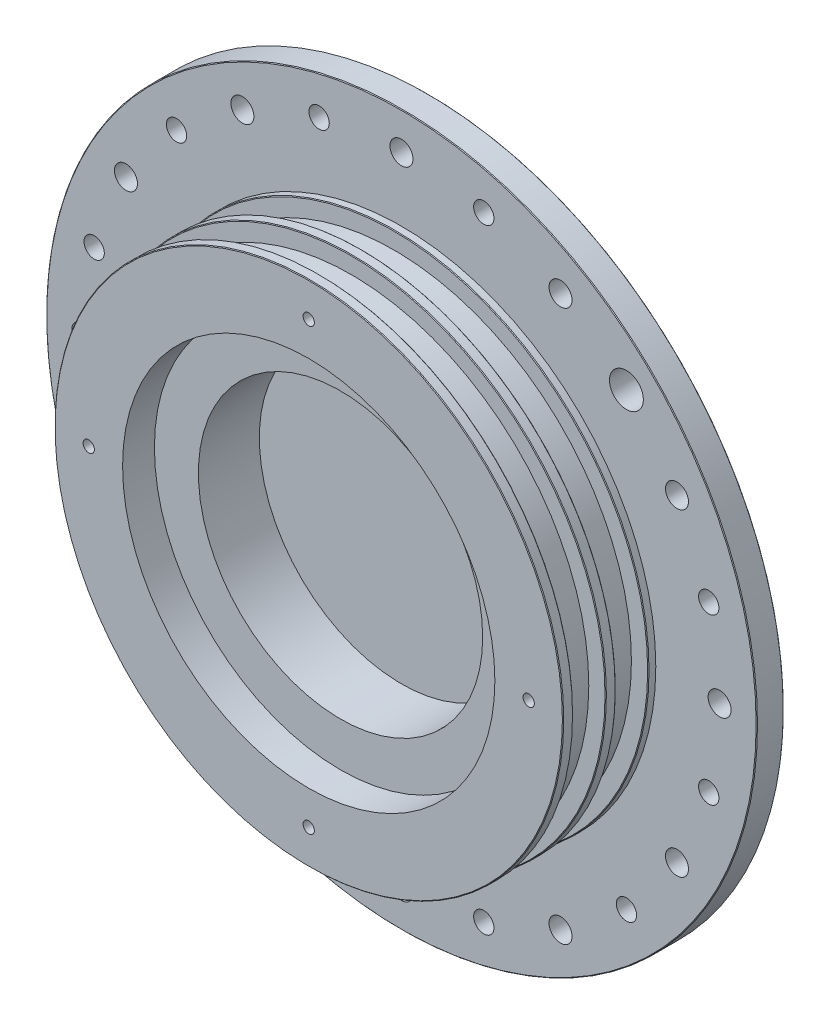
from build123d import *

# Parameters (mm, degrees)
DIAM_TRE_DU_PER_AGE_9_0_9_1_D     = 9
DIAM_TRE_DU_PER_AGE_9_0_9_1_DEPTH = 3
D_GAGEMENT_M31_D                  = 3.332
D_GAGEMENT_M31_DEPTH              = 16
D_GAGEMENT_M31_TIP                = 1.001033791
D_GAGEMENT_M1001_D                = 110
D_GAGEMENT_M1001_DEPTH            = 27.4
ESQUISSE8_R                       = 105
ESQUISSE8_R_2                     = 77.5
BOSS_EXTRU_1_DEPTH                = 8
ESQUISSE9_R                       = 3.4
ENL_V_MAT_EXTRU_1_DEPTH           = 20
ENL_V_MAT_EXTRU_15_DEPTH          = 153.653725798
ENL_V_MAT_EXTRU_15_DEPTH_BACK     = 153.653725798
ESQUISSE24_R                      = 3
ESQUISSE24_R_2                    = 5.1
ESQUISSE24_R_3                    = 5
CHANFREIN1_SIZE                   = 0.2
ENL_V_MAT_EXTRU_18_DEPTH          = 2
ESQUISSE35_R                      = 55
ESQUISSE35_R_2                    = 42
BOSS_EXTRU_4_DEPTH                = 18
BOSS_EXTRU_5_START                = -5
ESQUISSE36_R                      = 5.1
BOSS_EXTRU_5_DEPTH                = 5
ESQUISSE9_2_R                     = 3.4
ENL_V_MAT_EXTRU_20_DEPTH          = 20
R_P_TITION_CIRCULAIRE1_COUNT      = 8


with BuildPart() as part:
    # Esquisse1 → Révolution1 (revolve)
    with BuildSketch(Plane(origin=(0, 0, 0), x_dir=(1, 0, 0), z_dir=(0, 1, 0))):
        Polygon((87.5, 35.4), (0, 35.4), (0, 0), (75.15, 0), (75.15, 3), (70.15, 3), (70.15, 12.6), (75.15, 12.6), (75.15, 15.6), (70.15, 15.6), (70.15, 25.2), (75.15, 25.2), (75.15, 27.4), (87.5, 27.4), align=None)
    revolve(axis=Axis((0, 0, -35.4), (0, 0, 1)))

    # Diamètre du perçage Ø9.0 (9)1
    with Locations(Plane.XY.offset(-27.4)):
        with Locations((-87.5, 0), (0, 87.5), (0, -87.5), (87.5, 0)):
            Hole(DIAM_TRE_DU_PER_AGE_9_0_9_1_D / 2, depth=DIAM_TRE_DU_PER_AGE_9_0_9_1_DEPTH)

    # Dégagement M31
    with Locations(Plane.XY):
        with Locations((-65, 0), (65, 0), (0, 65), (0, -65)):
            Hole(D_GAGEMENT_M31_D / 2, depth=D_GAGEMENT_M31_DEPTH)
            with Locations((0, 0, -(D_GAGEMENT_M31_DEPTH + D_GAGEMENT_M31_TIP / 2))):  # 118° drill point
                Cone(0, D_GAGEMENT_M31_D / 2, D_GAGEMENT_M31_TIP, mode=Mode.SUBTRACT)

    # Dégagement M1001
    with Locations(Plane.XY):
        with Locations((0, 0)):
            Hole(D_GAGEMENT_M1001_D / 2, depth=D_GAGEMENT_M1001_DEPTH)

    # Esquisse8 → Boss.-Extru.1 (add)
    with BuildSketch(Plane(origin=(0, 0, -35.4), x_dir=(-1, 0, 0), z_dir=(0, 0, -1))):
        Circle(ESQUISSE8_R)
        Circle(ESQUISSE8_R_2, mode=Mode.SUBTRACT)
    extrude(amount=-BOSS_EXTRU_1_DEPTH)

    # Esquisse9 → Enlèv. mat.-Extru.1 (cut)
    with BuildSketch(Plane.XY.offset(-35.4)):
        with Locations((0, -50)):
            Circle(ESQUISSE9_R)
        with Locations((0, -94)):
            Circle(ESQUISSE9_R)
        with Locations((-25, -43.301270189)):
            Circle(ESQUISSE9_R)
        with Locations((-47, -81.406387956)):
            Circle(ESQUISSE9_R)
        with Locations((-43.301270189, -25)):
            Circle(ESQUISSE9_R)
        with Locations((-81.406387956, -47)):
            Circle(ESQUISSE9_R)
        with Locations((-50, 0)):
            Circle(ESQUISSE9_R)
        with Locations((-94, 0)):
            Circle(ESQUISSE9_R)
        with Locations((-43.301270189, 25)):
            Circle(ESQUISSE9_R)
        with Locations((-81.406387956, 47)):
            Circle(ESQUISSE9_R)
        with Locations((-25, 43.301270189)):
            Circle(ESQUISSE9_R)
        with Locations((-47, 81.406387956)):
            Circle(ESQUISSE9_R)
        with Locations((0, 50)):
            Circle(ESQUISSE9_R)
        with Locations((0, 94)):
            Circle(ESQUISSE9_R)
        with Locations((25, 43.301270189)):
            Circle(ESQUISSE9_R)
        with Locations((47, 81.406387956)):
            Circle(ESQUISSE9_R)
        with Locations((43.301270189, 25)):
            Circle(ESQUISSE9_R)
        with Locations((81.406387956, 47)):
            Circle(ESQUISSE9_R)
        with Locations((50, 0)):
            Circle(ESQUISSE9_R)
        with Locations((94, 0)):
            Circle(ESQUISSE9_R)
        with Locations((43.301270189, -25)):
            Circle(ESQUISSE9_R)
        with Locations((81.406387956, -47)):
            Circle(ESQUISSE9_R)
        with Locations((25, -43.301270189)):
            Circle(ESQUISSE9_R)
        with Locations((47, -81.406387956)):
            Circle(ESQUISSE9_R)
    extrude(amount=ENL_V_MAT_EXTRU_1_DEPTH, mode=Mode.SUBTRACT)

    # Esquisse24 → Enlèv. mat.-Extru.15 (cut, two sides: drawn at the far end of the back side and taken through both)
    with BuildSketch(Plane(origin=(0, 0, -35.4), x_dir=(-1, 0, 0), z_dir=(0, 0, -1)).offset(-ENL_V_MAT_EXTRU_15_DEPTH_BACK)):
        with Locations((24.32899024, 90.797027671)):
            Circle(ESQUISSE24_R)
        with Locations((66.468037432, 66.468037432)):
            Circle(ESQUISSE24_R)
        with Locations((90.797027671, 24.32899024)):
            Circle(ESQUISSE24_R)
        with Locations((90.797027671, -24.32899024)):
            Circle(ESQUISSE24_R)
        with Locations((-14, 24.248711306)):
            Circle(ESQUISSE24_R_2)
        with Locations((7.246933263, 27.045923136)):
            Circle(ESQUISSE24_R_2)
        with Locations((24.248711306, 14)):
            Circle(ESQUISSE24_R_2)
        with Locations((27.045923136, -7.246933263)):
            Circle(ESQUISSE24_R_2)
        with Locations((14, -24.248711306)):
            Circle(ESQUISSE24_R_2)
        with Locations((-7.246933263, -27.045923136)):
            Circle(ESQUISSE24_R_2)
        with Locations((-24.248711306, -14)):
            Circle(ESQUISSE24_R_2)
        with Locations((-27.045923136, 7.246933263)):
            Circle(ESQUISSE24_R_2)
        with Locations((-66.468037432, 66.468037432)):
            Circle(ESQUISSE24_R_3)
        with Locations((66.468037432, -66.468037432)):
            Circle(ESQUISSE24_R)
        with Locations((24.32899024, -90.797027671)):
            Circle(ESQUISSE24_R)
        with Locations((-24.32899024, -90.797027671)):
            Circle(ESQUISSE24_R)
        with Locations((-66.468037432, -66.468037432)):
            Circle(ESQUISSE24_R)
        with Locations((-90.797027671, -24.32899024)):
            Circle(ESQUISSE24_R)
        with Locations((-90.797027671, 24.32899024)):
            Circle(ESQUISSE24_R)
        with Locations((-24.32899024, 90.797027671)):
            Circle(ESQUISSE24_R)
        Circle(ESQUISSE24_R_2)
    extrude(amount=ENL_V_MAT_EXTRU_15_DEPTH + ENL_V_MAT_EXTRU_15_DEPTH_BACK, mode=Mode.SUBTRACT)

    # Chanfrein1
    chanfrein1_edges = [part.edges().sort_by_distance(p)[0] for p in [
        (-75.15, 0, -25.2),
        (-75.15, 0, -3),
        (-75.15, 0, -12.6),
        (-75.15, 0, -15.6),
        (105, 0, -35.4),
        (105, 0, -27.4),
        (-75.15, 0, 0),
    ]]
    chamfer(chanfrein1_edges, length=CHANFREIN1_SIZE)

    # Esquisse25 → Enlèv. mat.-Extru.18 (cut)
    with BuildSketch(Plane(origin=(0, 0, -35.4), x_dir=(-1, 0, 0), z_dir=(0, 0, -1))):
        with BuildLine():
            Line((-10.1, 3.137845559), (-10.1, -3.137845559))
            ThreePointArc((-10.1, -3.137845559), (-10.1, -4.604345773), (-9.404868295, -5.895629937))
            ThreePointArc((-9.404868295, -5.895629937), (0, -11.1), (9.404868295, -5.895629937))
            ThreePointArc((9.404868295, -5.895629937), (10.1, -4.604345773), (10.1, -3.137845559))
            Line((10.1, -3.137845559), (10.1, 3.137845559))
            ThreePointArc((10.1, 3.137845559), (10.1, 4.604345773), (9.404868295, 5.895629937))
            ThreePointArc((9.404868295, 5.895629937), (0, 11.1), (-9.404868295, 5.895629937))
            ThreePointArc((-9.404868295, 5.895629937), (-10.1, 4.604345773), (-10.1, 3.137845559))
        make_face()
        with BuildLine():
            Line((-22.534674305, 14.423884843), (-27.364303436, 15.717980069))
            ThreePointArc((-27.364303436, 15.717980069), (-27.626062148, 15.80113362), (-27.879119212, 15.907877515))
            ThreePointArc((-27.879119212, 15.907877515), (-29.43732897, 16.188098003), (-30.921195595, 15.636118826))
            ThreePointArc((-30.921195595, 15.636118826), (-31.100803738, 15.516590499), (-31.288537773, 15.410279455))
            ThreePointArc((-31.288537773, 15.410279455), (-35.932440738, 9.628068478), (-34.801808286, 2.298575399))
            ThreePointArc((-34.801808286, 2.298575399), (-34.692381365, 2.112640317), (-34.596600313, 1.919321678))
            ThreePointArc((-34.596600313, 1.919321678), (-33.587523709, 0.699360376), (-32.09796423, 0.162933558))
            ThreePointArc((-32.09796423, 0.162933558), (-31.825438437, 0.128847951), (-31.557171967, 0.069981683))
            Line((-31.557171967, 0.069981683), (-26.727542836, -1.224113543))
            ThreePointArc((-26.727542836, -1.224113543), (-26.465784124, -1.307267094), (-26.212727061, -1.414010989))
            ThreePointArc((-26.212727061, -1.414010989), (-24.654517302, -1.694231477), (-23.170650678, -1.1422523))
            ThreePointArc((-23.170650678, -1.1422523), (-22.991042534, -1.022723973), (-22.803308499, -0.916412929))
            ThreePointArc((-22.803308499, -0.916412929), (-18.159405534, 4.865798048), (-19.290037986, 12.195291126))
            ThreePointArc((-19.290037986, 12.195291126), (-19.399464908, 12.381226209), (-19.495245959, 12.574544848))
            ThreePointArc((-19.495245959, 12.574544848), (-20.504322564, 13.79450615), (-21.993882042, 14.330932968))
            ThreePointArc((-21.993882042, 14.330932968), (-22.266407835, 14.365018575), (-22.534674305, 14.423884843))
        make_face()
        with BuildLine():
            Line((-5.735194229, 26.133647797), (-8.235194229, 30.463774815))
            ThreePointArc((-8.235194229, 30.463774815), (-8.36148715, 30.707664616), (-8.464946183, 30.962082313))
            ThreePointArc((-8.464946183, 30.962082313), (-9.368621062, 32.262048807), (-10.808181434, 32.92099274))
            ThreePointArc((-10.808181434, 32.92099274), (-11.019702861, 32.963475586), (-11.22762413, 33.021050335))
            ThreePointArc((-11.22762413, 33.021050335), (-18.6, 32.216145021), (-22.983256384, 26.233932888))
            ThreePointArc((-22.983256384, 26.233932888), (-23.037355824, 26.025080413), (-23.106325314, 25.820656061))
            ThreePointArc((-23.106325314, 25.820656061), (-23.255443313, 24.244488242), (-22.581476746, 22.811899593))
            ThreePointArc((-22.581476746, 22.811899593), (-22.412874073, 22.595092593), (-22.264805771, 22.363774815))
            Line((-22.264805771, 22.363774815), (-19.764805771, 18.033647797))
            ThreePointArc((-19.764805771, 18.033647797), (-19.63851285, 17.789757996), (-19.535053817, 17.535340299))
            ThreePointArc((-19.535053817, 17.535340299), (-18.631378938, 16.235373805), (-17.191818566, 15.576429871))
            ThreePointArc((-17.191818566, 15.576429871), (-16.980297139, 15.533947026), (-16.77237587, 15.476372277))
            ThreePointArc((-16.77237587, 15.476372277), (-9.4, 16.281277591), (-5.016743616, 22.263489724))
            ThreePointArc((-5.016743616, 22.263489724), (-4.962644176, 22.472342199), (-4.893674686, 22.676766551))
            ThreePointArc((-4.893674686, 22.676766551), (-4.744556687, 24.25293437), (-5.418523254, 25.685523019))
            ThreePointArc((-5.418523254, 25.685523019), (-5.587125927, 25.902330019), (-5.735194229, 26.133647797))
        make_face()
        with BuildLine():
            Line((14.423884843, 22.534674305), (15.717980069, 27.364303436))
            ThreePointArc((15.717980069, 27.364303436), (15.80113362, 27.626062148), (15.907877515, 27.879119212))
            ThreePointArc((15.907877515, 27.879119212), (16.188098003, 29.43732897), (15.636118826, 30.921195595))
            ThreePointArc((15.636118826, 30.921195595), (15.516590499, 31.100803738), (15.410279455, 31.288537773))
            ThreePointArc((15.410279455, 31.288537773), (9.628068478, 35.932440738), (2.298575399, 34.801808286))
            ThreePointArc((2.298575399, 34.801808286), (2.112640317, 34.692381365), (1.919321678, 34.596600313))
            ThreePointArc((1.919321678, 34.596600313), (0.699360376, 33.587523709), (0.162933558, 32.09796423))
            ThreePointArc((0.162933558, 32.09796423), (0.128847951, 31.825438437), (0.069981683, 31.557171967))
            Line((0.069981683, 31.557171967), (-1.224113543, 26.727542836))
            ThreePointArc((-1.224113543, 26.727542836), (-1.307267094, 26.465784124), (-1.414010989, 26.212727061))
            ThreePointArc((-1.414010989, 26.212727061), (-1.694231477, 24.654517302), (-1.1422523, 23.170650678))
            ThreePointArc((-1.1422523, 23.170650678), (-1.022723973, 22.991042534), (-0.916412929, 22.803308499))
            ThreePointArc((-0.916412929, 22.803308499), (4.865798048, 18.159405534), (12.195291126, 19.290037986))
            ThreePointArc((12.195291126, 19.290037986), (12.381226209, 19.399464908), (12.574544848, 19.495245959))
            ThreePointArc((12.574544848, 19.495245959), (13.79450615, 20.504322564), (14.330932968, 21.993882042))
            ThreePointArc((14.330932968, 21.993882042), (14.365018575, 22.266407835), (14.423884843, 22.534674305))
        make_face()
        with BuildLine():
            Line((26.133647797, 5.735194229), (30.463774815, 8.235194229))
            ThreePointArc((30.463774815, 8.235194229), (30.707664616, 8.36148715), (30.962082313, 8.464946183))
            ThreePointArc((30.962082313, 8.464946183), (32.262048807, 9.368621062), (32.92099274, 10.808181434))
            ThreePointArc((32.92099274, 10.808181434), (32.963475586, 11.019702861), (33.021050335, 11.22762413))
            ThreePointArc((33.021050335, 11.22762413), (32.216145021, 18.6), (26.233932888, 22.983256384))
            ThreePointArc((26.233932888, 22.983256384), (26.025080413, 23.037355824), (25.820656061, 23.106325314))
            ThreePointArc((25.820656061, 23.106325314), (24.244488242, 23.255443313), (22.811899593, 22.581476746))
            ThreePointArc((22.811899593, 22.581476746), (22.595092593, 22.412874073), (22.363774815, 22.264805771))
            Line((22.363774815, 22.264805771), (18.033647797, 19.764805771))
            ThreePointArc((18.033647797, 19.764805771), (17.789757996, 19.63851285), (17.535340299, 19.535053817))
            ThreePointArc((17.535340299, 19.535053817), (16.235373805, 18.631378938), (15.576429871, 17.191818566))
            ThreePointArc((15.576429871, 17.191818566), (15.533947026, 16.980297139), (15.476372277, 16.77237587))
            ThreePointArc((15.476372277, 16.77237587), (16.281277591, 9.4), (22.263489724, 5.016743616))
            ThreePointArc((22.263489724, 5.016743616), (22.472342199, 4.962644176), (22.676766551, 4.893674686))
            ThreePointArc((22.676766551, 4.893674686), (24.25293437, 4.744556687), (25.685523019, 5.418523254))
            ThreePointArc((25.685523019, 5.418523254), (25.902330019, 5.587125927), (26.133647797, 5.735194229))
        make_face()
        with BuildLine():
            Line((22.534674305, -14.423884843), (27.364303436, -15.717980069))
            ThreePointArc((27.364303436, -15.717980069), (27.626062148, -15.80113362), (27.879119212, -15.907877515))
            ThreePointArc((27.879119212, -15.907877515), (29.43732897, -16.188098003), (30.921195595, -15.636118826))
            ThreePointArc((30.921195595, -15.636118826), (31.100803738, -15.516590499), (31.288537773, -15.410279455))
            ThreePointArc((31.288537773, -15.410279455), (35.932440738, -9.628068478), (34.801808286, -2.298575399))
            ThreePointArc((34.801808286, -2.298575399), (34.692381365, -2.112640317), (34.596600313, -1.919321678))
            ThreePointArc((34.596600313, -1.919321678), (33.587523709, -0.699360376), (32.09796423, -0.162933558))
            ThreePointArc((32.09796423, -0.162933558), (31.825438437, -0.128847951), (31.557171967, -0.069981683))
            Line((31.557171967, -0.069981683), (26.727542836, 1.224113543))
            ThreePointArc((26.727542836, 1.224113543), (26.465784124, 1.307267094), (26.212727061, 1.414010989))
            ThreePointArc((26.212727061, 1.414010989), (24.654517302, 1.694231477), (23.170650678, 1.1422523))
            ThreePointArc((23.170650678, 1.1422523), (22.991042534, 1.022723973), (22.803308499, 0.916412929))
            ThreePointArc((22.803308499, 0.916412929), (18.159405534, -4.865798048), (19.290037986, -12.195291126))
            ThreePointArc((19.290037986, -12.195291126), (19.399464908, -12.381226209), (19.495245959, -12.574544848))
            ThreePointArc((19.495245959, -12.574544848), (20.504322564, -13.79450615), (21.993882042, -14.330932968))
            ThreePointArc((21.993882042, -14.330932968), (22.266407835, -14.365018575), (22.534674305, -14.423884843))
        make_face()
        with BuildLine():
            Line((5.735194229, -26.133647797), (8.235194229, -30.463774815))
            ThreePointArc((8.235194229, -30.463774815), (8.36148715, -30.707664616), (8.464946183, -30.962082313))
            ThreePointArc((8.464946183, -30.962082313), (9.368621062, -32.262048807), (10.808181434, -32.92099274))
            ThreePointArc((10.808181434, -32.92099274), (11.019702861, -32.963475586), (11.22762413, -33.021050335))
            ThreePointArc((11.22762413, -33.021050335), (18.6, -32.216145021), (22.983256384, -26.233932888))
            ThreePointArc((22.983256384, -26.233932888), (23.037355824, -26.025080413), (23.106325314, -25.820656061))
            ThreePointArc((23.106325314, -25.820656061), (23.255443313, -24.244488242), (22.581476746, -22.811899593))
            ThreePointArc((22.581476746, -22.811899593), (22.412874073, -22.595092593), (22.264805771, -22.363774815))
            Line((22.264805771, -22.363774815), (19.764805771, -18.033647797))
            ThreePointArc((19.764805771, -18.033647797), (19.63851285, -17.789757996), (19.535053817, -17.535340299))
            ThreePointArc((19.535053817, -17.535340299), (18.631378938, -16.235373805), (17.191818566, -15.576429871))
            ThreePointArc((17.191818566, -15.576429871), (16.980297139, -15.533947026), (16.77237587, -15.476372277))
            ThreePointArc((16.77237587, -15.476372277), (9.4, -16.281277591), (5.016743616, -22.263489724))
            ThreePointArc((5.016743616, -22.263489724), (4.962644176, -22.472342199), (4.893674686, -22.676766551))
            ThreePointArc((4.893674686, -22.676766551), (4.744556687, -24.25293437), (5.418523254, -25.685523019))
            ThreePointArc((5.418523254, -25.685523019), (5.587125927, -25.902330019), (5.735194229, -26.133647797))
        make_face()
        with BuildLine():
            Line((-14.423884843, -22.534674305), (-15.717980069, -27.364303436))
            ThreePointArc((-15.717980069, -27.364303436), (-15.80113362, -27.626062148), (-15.907877515, -27.879119212))
            ThreePointArc((-15.907877515, -27.879119212), (-16.188098003, -29.43732897), (-15.636118826, -30.921195595))
            ThreePointArc((-15.636118826, -30.921195595), (-15.516590499, -31.100803738), (-15.410279455, -31.288537773))
            ThreePointArc((-15.410279455, -31.288537773), (-9.628068478, -35.932440738), (-2.298575399, -34.801808286))
            ThreePointArc((-2.298575399, -34.801808286), (-2.112640317, -34.692381365), (-1.919321678, -34.596600313))
            ThreePointArc((-1.919321678, -34.596600313), (-0.699360376, -33.587523709), (-0.162933558, -32.09796423))
            ThreePointArc((-0.162933558, -32.09796423), (-0.128847951, -31.825438437), (-0.069981683, -31.557171967))
            Line((-0.069981683, -31.557171967), (1.224113543, -26.727542836))
            ThreePointArc((1.224113543, -26.727542836), (1.307267094, -26.465784124), (1.414010989, -26.212727061))
            ThreePointArc((1.414010989, -26.212727061), (1.694231477, -24.654517302), (1.1422523, -23.170650678))
            ThreePointArc((1.1422523, -23.170650678), (1.022723973, -22.991042534), (0.916412929, -22.803308499))
            ThreePointArc((0.916412929, -22.803308499), (-4.865798048, -18.159405534), (-12.195291126, -19.290037986))
            ThreePointArc((-12.195291126, -19.290037986), (-12.381226209, -19.399464908), (-12.574544848, -19.495245959))
            ThreePointArc((-12.574544848, -19.495245959), (-13.79450615, -20.504322564), (-14.330932968, -21.993882042))
            ThreePointArc((-14.330932968, -21.993882042), (-14.365018575, -22.266407835), (-14.423884843, -22.534674305))
        make_face()
        with BuildLine():
            Line((-26.133647797, -5.735194229), (-30.463774815, -8.235194229))
            ThreePointArc((-30.463774815, -8.235194229), (-30.707664616, -8.36148715), (-30.962082313, -8.464946183))
            ThreePointArc((-30.962082313, -8.464946183), (-32.262048807, -9.368621062), (-32.92099274, -10.808181434))
            ThreePointArc((-32.92099274, -10.808181434), (-32.963475586, -11.019702861), (-33.021050335, -11.22762413))
            ThreePointArc((-33.021050335, -11.22762413), (-32.216145021, -18.6), (-26.233932888, -22.983256384))
            ThreePointArc((-26.233932888, -22.983256384), (-26.025080413, -23.037355824), (-25.820656061, -23.106325314))
            ThreePointArc((-25.820656061, -23.106325314), (-24.244488242, -23.255443313), (-22.811899593, -22.581476746))
            ThreePointArc((-22.811899593, -22.581476746), (-22.595092593, -22.412874073), (-22.363774815, -22.264805771))
            Line((-22.363774815, -22.264805771), (-18.033647797, -19.764805771))
            ThreePointArc((-18.033647797, -19.764805771), (-17.789757996, -19.63851285), (-17.535340299, -19.535053817))
            ThreePointArc((-17.535340299, -19.535053817), (-16.235373805, -18.631378938), (-15.576429871, -17.191818566))
            ThreePointArc((-15.576429871, -17.191818566), (-15.533947026, -16.980297139), (-15.476372277, -16.77237587))
            ThreePointArc((-15.476372277, -16.77237587), (-16.281277591, -9.4), (-22.263489724, -5.016743616))
            ThreePointArc((-22.263489724, -5.016743616), (-22.472342199, -4.962644176), (-22.676766551, -4.893674686))
            ThreePointArc((-22.676766551, -4.893674686), (-24.25293437, -4.744556687), (-25.685523019, -5.418523254))
            ThreePointArc((-25.685523019, -5.418523254), (-25.902330019, -5.587125927), (-26.133647797, -5.735194229))
        make_face()
    extrude(amount=-ENL_V_MAT_EXTRU_18_DEPTH, mode=Mode.SUBTRACT)

    # Esquisse35 → Boss.-Extru.4 (add)
    with BuildSketch(Plane.XY.offset(-27.4)):
        Circle(ESQUISSE35_R)
        Circle(ESQUISSE35_R_2, mode=Mode.SUBTRACT)
    extrude(amount=BOSS_EXTRU_4_DEPTH)

    # Esquisse36 → Boss.-Extru.5 (add)
    with BuildSketch(Plane.XY.offset(-27.4).offset(BOSS_EXTRU_5_START)):
        with Locations((-27.045923136, -7.246933263)):
            Circle(ESQUISSE36_R)
        with Locations((-24.248711306, 14)):
            Circle(ESQUISSE36_R)
        with Locations((-7.246933263, 27.045923136)):
            Circle(ESQUISSE36_R)
        with Locations((14, 24.248711306)):
            Circle(ESQUISSE36_R)
        with Locations((27.045923136, 7.246933263)):
            Circle(ESQUISSE36_R)
        with Locations((24.248711306, -14)):
            Circle(ESQUISSE36_R)
        with Locations((7.246933263, -27.045923136)):
            Circle(ESQUISSE36_R)
        with Locations((-14, -24.248711306)):
            Circle(ESQUISSE36_R)
        Circle(ESQUISSE36_R)
    extrude(amount=BOSS_EXTRU_5_DEPTH)

    # Esquisse9<2> → Enlèv. mat.-Extru.20 (cut)
    with BuildSketch(Plane.XY.offset(-35.4)):
        with Locations((0, -50)):
            Circle(ESQUISSE9_2_R)
        with Locations((0, -94)):
            Circle(ESQUISSE9_2_R)
        with Locations((-25, -43.301270189)):
            Circle(ESQUISSE9_2_R)
        with Locations((-47, -81.406387956)):
            Circle(ESQUISSE9_2_R)
        with Locations((-43.301270189, -25)):
            Circle(ESQUISSE9_2_R)
        with Locations((-81.406387956, -47)):
            Circle(ESQUISSE9_2_R)
        with Locations((-50, 0)):
            Circle(ESQUISSE9_2_R)
        with Locations((-94, 0)):
            Circle(ESQUISSE9_2_R)
        with Locations((-43.301270189, 25)):
            Circle(ESQUISSE9_2_R)
        with Locations((-81.406387956, 47)):
            Circle(ESQUISSE9_2_R)
        with Locations((-25, 43.301270189)):
            Circle(ESQUISSE9_2_R)
        with Locations((-47, 81.406387956)):
            Circle(ESQUISSE9_2_R)
        with Locations((0, 50)):
            Circle(ESQUISSE9_2_R)
        with Locations((0, 94)):
            Circle(ESQUISSE9_2_R)
        with Locations((25, 43.301270189)):
            Circle(ESQUISSE9_2_R)
        with Locations((47, 81.406387956)):
            Circle(ESQUISSE9_2_R)
        with Locations((43.301270189, 25)):
            Circle(ESQUISSE9_2_R)
        with Locations((81.406387956, 47)):
            Circle(ESQUISSE9_2_R)
        with Locations((50, 0)):
            Circle(ESQUISSE9_2_R)
        with Locations((94, 0)):
            Circle(ESQUISSE9_2_R)
        with Locations((43.301270189, -25)):
            Circle(ESQUISSE9_2_R)
        with Locations((81.406387956, -47)):
            Circle(ESQUISSE9_2_R)
        with Locations((25, -43.301270189)):
            Circle(ESQUISSE9_2_R)
        with Locations((47, -81.406387956)):
            Circle(ESQUISSE9_2_R)
    extrude(amount=ENL_V_MAT_EXTRU_20_DEPTH, mode=Mode.SUBTRACT)

    # Esquisse38 → Enlèvement de matière-Révolution4 (revolve, cut)
    with BuildSketch(Plane(origin=(0, 0, 0), x_dir=(0, 0, 1), z_dir=(-0.8660254037844345, 0.500000000000007, 0))):
        Polygon((-35.4, 28), (-30.4, 28), (-32.4, 33.1), (-35.4, 33.1), align=None)
    enl_vement_de_mati_re_r_volution4 = revolve(axis=Axis((14, 24.248711306, -35.4), (0, 0, 1)), mode=Mode.SUBTRACT)

    # Répétition circulaire1: Enlèvement de matière-Révolution4 ×8 about axis
    r_p_tition_circulaire1_axis = Axis((0, 0, -32.4), (0, 0, -1))
    for i in range(1, R_P_TITION_CIRCULAIRE1_COUNT):
        add(enl_vement_de_mati_re_r_volution4.rotate(r_p_tition_circulaire1_axis, i * 360 / R_P_TITION_CIRCULAIRE1_COUNT), mode=Mode.SUBTRACT)

    # Esquisse39 → Enlèvement de matière-Révolution5 (revolve, cut)
    with BuildSketch(Plane(origin=(0, 0, 0), x_dir=(0, 0, 1), z_dir=(-0.8660254037844345, 0.500000000000007, 0))):
        Polygon((-35.4, 0), (-35.4, 7.1), (-32.4, 7.1), (-30.4, 0), align=None)
    revolve(axis=Axis((0, 0, 0), (0, 0, -1)), mode=Mode.SUBTRACT)


solid = part.part
